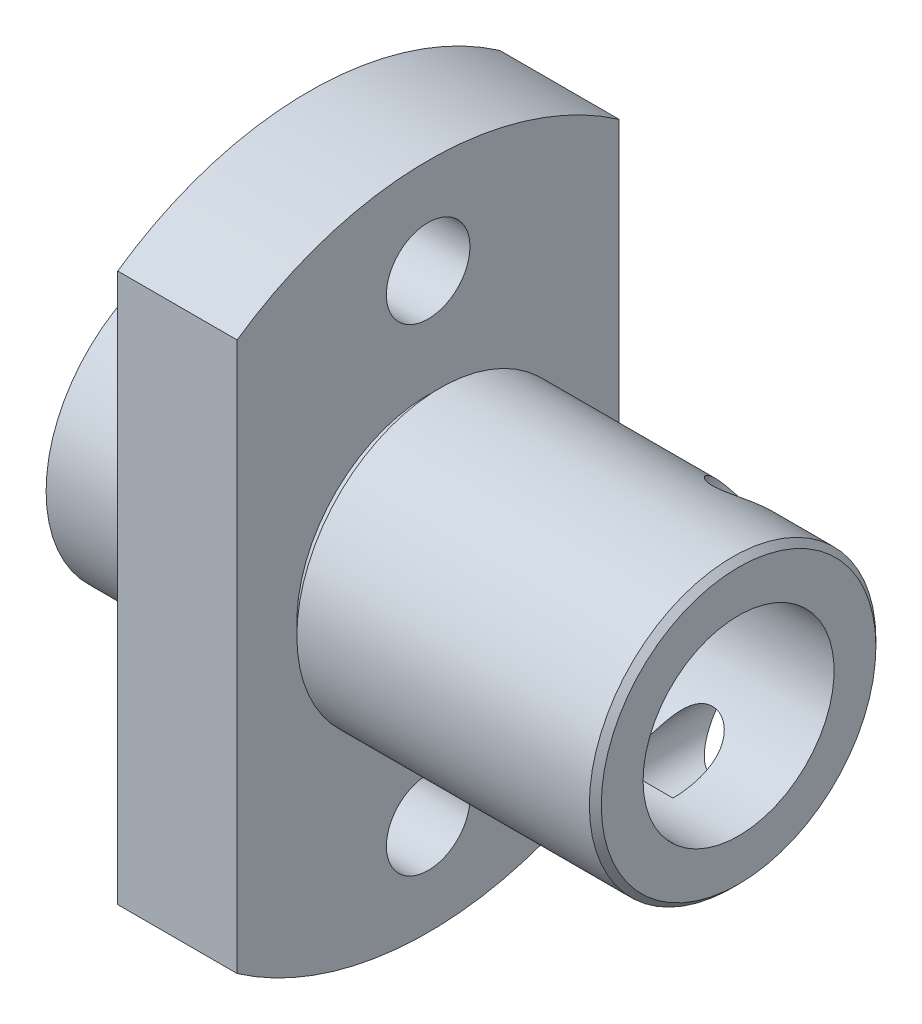
from build123d import *

# Parameters (mm, degrees)
SKETCH_2_R                 = 1.75
EXTRUDE_1_DEPTH            = 5
EXTRUDE_3_DEPTH            = 5
EXTRUDE_3_DEPTH_BACK       = 18
SKETCH_3_R                 = 6
SKETCH_3_R_2               = 4
CUT_EXTRUDE_2_DEPTH        = 25.166091947
CUT_EXTRUDE_2_DEPTH_BACK   = 25.166091947
SKETCH_7_R                 = 4
HOLE_START                 = -5.332682415
HOLE_WIZARD_M3_2_OUTLINE_R = 1.25
HOLE_WIZARD_M3_2_DEPTH     = 5.332682415
CHAMFER_2_SIZE             = 0.25
SKETCH_13_R                = 6
SKETCH_13_R_2              = 5.5
CUT_EXTRUDE_4_DEPTH        = 0.5


# Read off the part's stored shape, not the designer's step: M3 螺纹孔2
with BuildPart() as part:
    # 草图2 → 凸台-拉伸1 (new body)
    with BuildSketch(Plane(origin=(0, 0, 0), x_dir=(0, 0, -1), z_dir=(1, 0, 0))):
        with BuildLine():
            Line((-8, 11.489125293), (-8, -11.489125293))
            ThreePointArc((-8, -11.489125293), (0, -14), (8, -11.489125293))
            Line((8, -11.489125293), (8, 11.489125293))
            ThreePointArc((8, 11.489125293), (0, 14), (-8, 11.489125293))
        make_face()
        with Locations((0, 10)):
            Circle(SKETCH_2_R, mode=Mode.SUBTRACT)
        with Locations(Location((0, -10, 0), (0, 0, 180))):
            Circle(SKETCH_2_R, mode=Mode.SUBTRACT)
    extrude(amount=EXTRUDE_1_DEPTH)

    # 草图3 → 凸台-拉伸3 (add, two sides: drawn at the far end of the back side and taken through both)
    with BuildSketch(Plane.ZY.offset(-EXTRUDE_3_DEPTH_BACK)):
        Circle(SKETCH_3_R)
        Circle(SKETCH_3_R_2, mode=Mode.SUBTRACT)
    extrude(amount=EXTRUDE_3_DEPTH + EXTRUDE_3_DEPTH_BACK)

    # 草图7 → 切除-拉伸2 (cut, two sides: drawn at the far end of the back side and taken through both)
    with BuildSketch(Plane.ZY.offset(-CUT_EXTRUDE_2_DEPTH_BACK)):
        Circle(SKETCH_7_R)
    extrude(amount=CUT_EXTRUDE_2_DEPTH + CUT_EXTRUDE_2_DEPTH_BACK, mode=Mode.SUBTRACT)

    # M3 螺纹孔2 outline → M3 螺纹孔2 (cut)
    with BuildSketch(Plane.XY.offset(HOLE_START)):
        with Locations((14, -4)):
            Circle(HOLE_WIZARD_M3_2_OUTLINE_R)
        with Locations((14, 4)):
            Circle(HOLE_WIZARD_M3_2_OUTLINE_R)
    extrude(amount=HOLE_WIZARD_M3_2_DEPTH, mode=Mode.SUBTRACT)

    # 倒角2
    chamfer_2_edges = [part.edges().sort_by_distance(p)[0] for p in [
        (18, 0, -6),
    ]]
    chamfer(chamfer_2_edges, length=CHAMFER_2_SIZE)

    # 草图13 → 切除-拉伸4 (cut)
    with BuildSketch(Plane(origin=(5.5, 0, 0), x_dir=(0, 0, -1), z_dir=(1, 0, 0))):
        with Locations(Location((0, 0, 0), (0, 0, 180))):
            Circle(SKETCH_13_R)
        Circle(SKETCH_13_R_2, mode=Mode.SUBTRACT)
    extrude(amount=-CUT_EXTRUDE_4_DEPTH, mode=Mode.SUBTRACT)


solid = part.part
